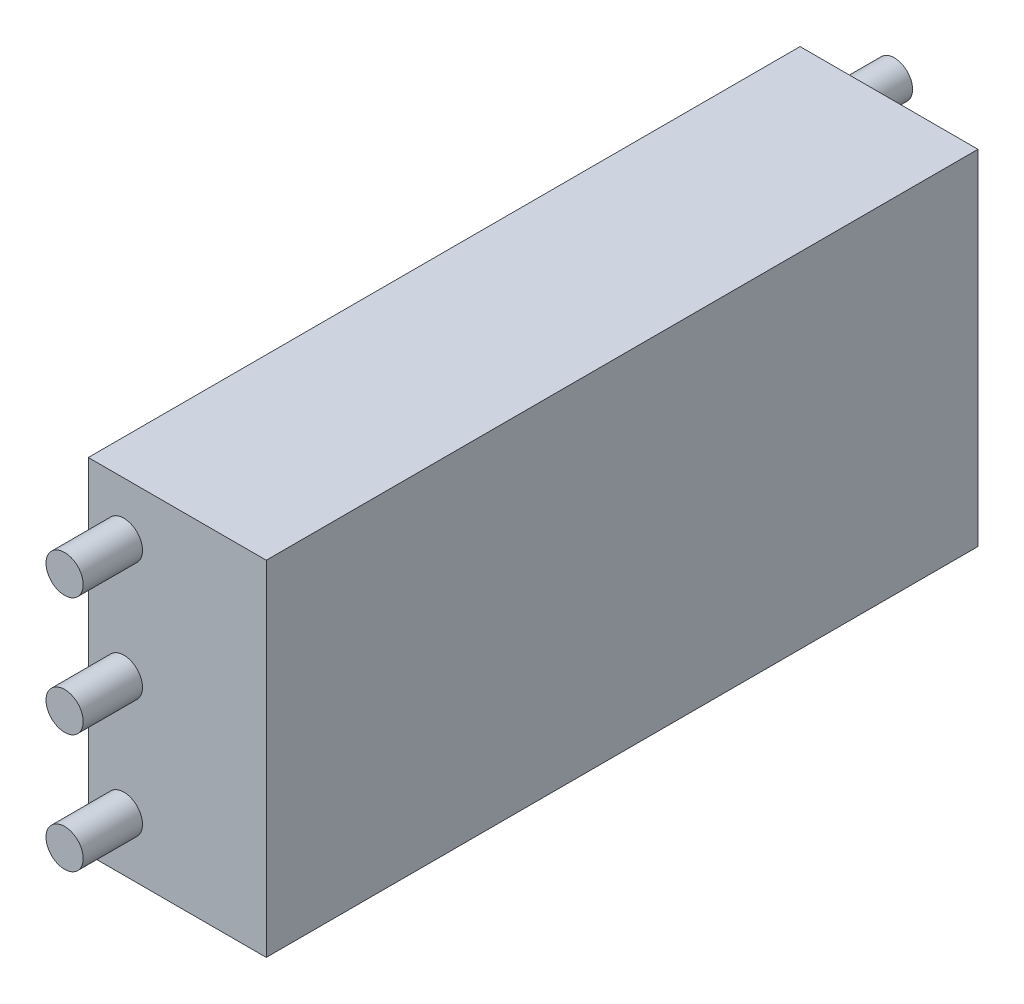
from build123d import *

# Parameters (mm, degrees)
SKETCH1_W           = 60
SKETCH1_H           = 29
BOSS_EXTRUDE1_DEPTH = 15
SKETCH2_R           = 1.567394172
BOSS_EXTRUDE2_DEPTH = 5
SKETCH3_R           = 1.539361
BOSS_EXTRUDE3_DEPTH = 5


with BuildPart() as part:
    # Sketch1 → Boss-Extrude1 (new body)
    with BuildSketch(Plane(origin=(0, 0, 0), x_dir=(0, 0, -1), z_dir=(1, 0, 0))):
        with Locations((30, 14.5)):
            Rectangle(SKETCH1_W, SKETCH1_H)
    extrude(amount=BOSS_EXTRUDE1_DEPTH)

    # Sketch2 → Boss-Extrude2 (add)
    with BuildSketch(Plane.XY):
        with Locations((3, 24.5)):
            Circle(SKETCH2_R)
        with Locations((3, 14.5)):
            Circle(SKETCH2_R)
        with Locations((3, 4.5)):
            Circle(SKETCH2_R)
    extrude(amount=BOSS_EXTRUDE2_DEPTH)

    # Sketch3 → Boss-Extrude3 (add)
    with BuildSketch(Plane(origin=(0, 0, -60), x_dir=(-1, 0, 0), z_dir=(0, 0, -1))):
        with Locations((-2.947414971, 25.615179296)):
            Circle(SKETCH3_R)
        with Locations((-2.947414971, 3.419179836)):
            Circle(SKETCH3_R)
    extrude(amount=BOSS_EXTRUDE3_DEPTH)


solid = part.part
